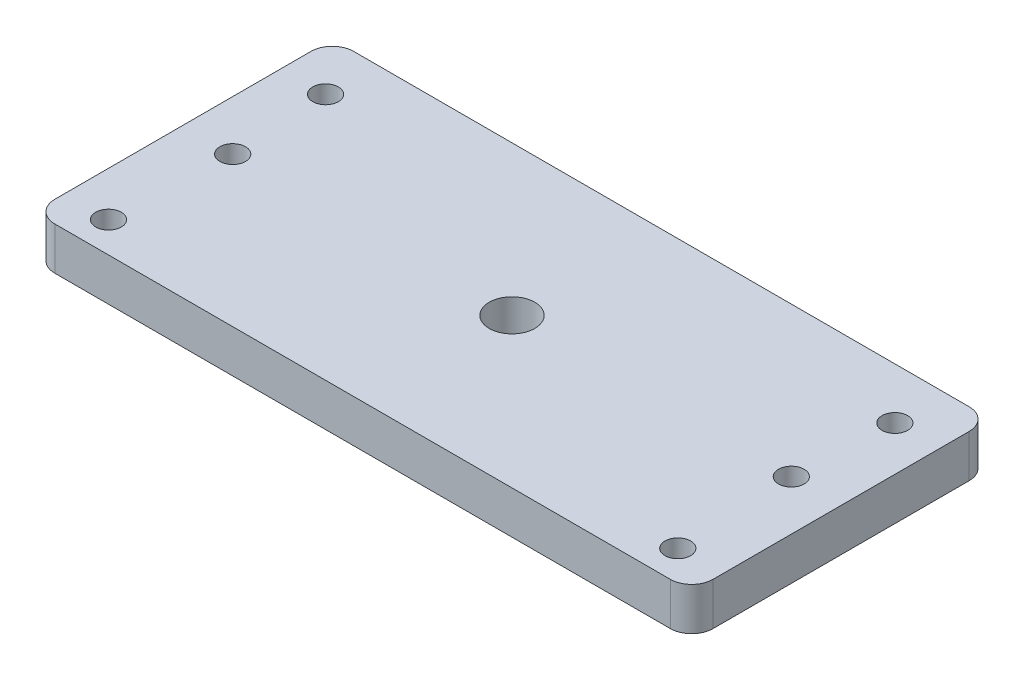
from build123d import *
from build123d.topology import SkipClean

# Parameters (mm, degrees)
SKETCH2_W                                            = 92.5
SKETCH2_H                                            = 42
SKETCH2_R                                            = 3.2
BOSS_EXTRUDE1_DEPTH                                  = 6
M3_CLEARANCE_HOLE1_D                                 = 3.6
M3_CLEARANCE_HOLE1_DEPTH                             = 10
M3_CLEARANCE_HOLE1_TIP                               = 1.081549114
BOSS_EXTRUDE2_START                                  = 3
SKETCH7_R                                            = 7.2
SKETCH7_R_2                                          = 3.2
BOSS_EXTRUDE2_DEPTH                                  = 3
CHAMFER1_SIZE                                        = 3
FILLET1_R                                            = 3
CSK_FOR_M3_HEX_SOCKET_COUNTERSUNK_HEAD_S_D           = 3.6
CSK_FOR_M3_HEX_SOCKET_COUNTERSUNK_HEAD_S_CSINK_D     = 6.94
CSK_FOR_M3_HEX_SOCKET_COUNTERSUNK_HEAD_S_CSINK_ANGLE = 90


with BuildPart() as part:
    # Sketch2 → Boss-Extrude1 (new body)
    with BuildSketch(Plane(origin=(0, 0, 0), x_dir=(1, 0, 0), z_dir=(0, 1, 0))):
        with Locations((20.253338886, 13.715343577)):
            Rectangle(SKETCH2_W, SKETCH2_H)
        with Locations(Location((20.253338886, 13.715343577, 0), (0, 0, 270))):
            Circle(SKETCH2_R, mode=Mode.SUBTRACT)
    extrude(amount=BOSS_EXTRUDE1_DEPTH)

    # M3 Clearance Hole1
    with Locations(Plane(origin=(0, 0, 0), x_dir=(-1, 0, 0), z_dir=(0, -1, 0))):
        with Locations((-60.253338886, 27.515343577), (-60.253338886, -2.984656423), (19.746661114, -2.984656423), (19.746661114, 27.515343577)):
            Hole(M3_CLEARANCE_HOLE1_D / 2, depth=M3_CLEARANCE_HOLE1_DEPTH)
            with Locations((0, 0, -(M3_CLEARANCE_HOLE1_DEPTH + M3_CLEARANCE_HOLE1_TIP / 2))):  # 118° drill point
                Cone(0, M3_CLEARANCE_HOLE1_D / 2, M3_CLEARANCE_HOLE1_TIP, mode=Mode.SUBTRACT)

    # Sketch7 → Boss-Extrude2 (add)
    with SkipClean():  # the faces are left unmerged after this step: merging them gives an invalid solid
        with BuildSketch(Plane.XZ.offset(BOSS_EXTRUDE2_START)):
            with Locations(Location((20.253338886, -13.715343577, 0), (0, 0, 90))):
                Circle(SKETCH7_R)
            with Locations(Location((20.253338886, -13.715343577, 0), (0, 0, 270))):
                Circle(SKETCH7_R_2, mode=Mode.SUBTRACT)
        extrude(amount=-BOSS_EXTRUDE2_DEPTH)

    # Chamfer1
    chamfer1_edges = [part.edges().sort_by_distance(p)[0] for p in [
        (20.253338886, 0, -20.915343577),
    ]]
    chamfer(chamfer1_edges, length=CHAMFER1_SIZE - 0.0001)  # a hair under: the kernel refuses the full size

    # Fillet1
    fillet1_edges = [part.edges().sort_by_distance(p)[0] for p in [
        (-25.996661114, 3, -34.715343577),
        (66.503338886, 3, -34.715343577),
        (66.503338886, 3, 7.284656423),
        (-25.996661114, 3, 7.284656423),
    ]]
    fillet(fillet1_edges, radius=FILLET1_R)

    # CSK for M3 Hex Socket Countersunk Head Screw1 (through all)
    with Locations(Plane(origin=(0, 0, 0), x_dir=(-1, 0, 0), z_dir=(0, -1, 0))):
        with Locations((-59.503338886, 13.715343577), (18.996661114, 13.715343577)):
            CounterSinkHole(CSK_FOR_M3_HEX_SOCKET_COUNTERSUNK_HEAD_S_D / 2, CSK_FOR_M3_HEX_SOCKET_COUNTERSUNK_HEAD_S_CSINK_D / 2, counter_sink_angle=CSK_FOR_M3_HEX_SOCKET_COUNTERSUNK_HEAD_S_CSINK_ANGLE)


solid = part.part
